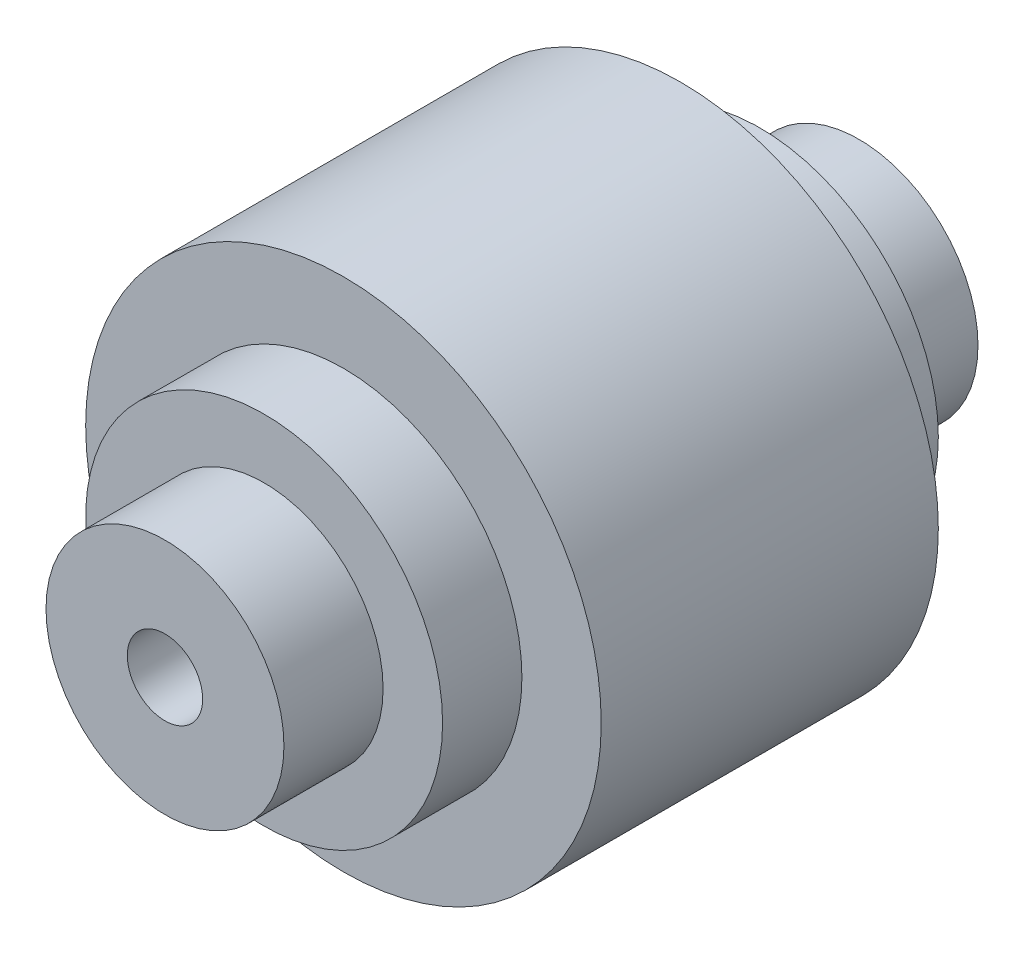
from build123d import *

# Parameters (mm, degrees)
SKETCH_2_R           = 1.9
CUT_EXTRUDE_1_DEPTH  = 36
EXTRUDE_1_DEPTH      = 4
EXTRUDE_1_DEPTH_BACK = 21
SKETCH_4_R           = 9


with BuildPart() as part:
    # 草图1 → 旋转1 (revolve)
    with BuildSketch(Plane(origin=(0, 0, 0), x_dir=(1, 0, 0), z_dir=(0, 1, 0))):
        Polygon((0, -1e-09), (0, -35), (6, -35), (6, -30), (7.5, -30), (7.5, -26), (9, -26), (13, -26), (13, -9), (9, -9), (7.5, -9), (7.5, -5), (6, -5), (6, -1e-09), align=None)
    revolve(axis=Axis((0, 0, 1e-09), (0, 0, 1)))

    # 草图2 → 切除-拉伸1 (cut)
    with BuildSketch(Plane.XY.offset(35)):
        Circle(SKETCH_2_R)
    extrude(amount=-CUT_EXTRUDE_1_DEPTH, mode=Mode.SUBTRACT)

    # 草图4 → 凸台-拉伸1 (add, two sides: drawn at the far end of the back side and taken through both)
    with BuildSketch(Plane.XY.offset(26).offset(-EXTRUDE_1_DEPTH_BACK)):
        Circle(SKETCH_4_R)
    extrude(amount=EXTRUDE_1_DEPTH + EXTRUDE_1_DEPTH_BACK)


solid = part.part
